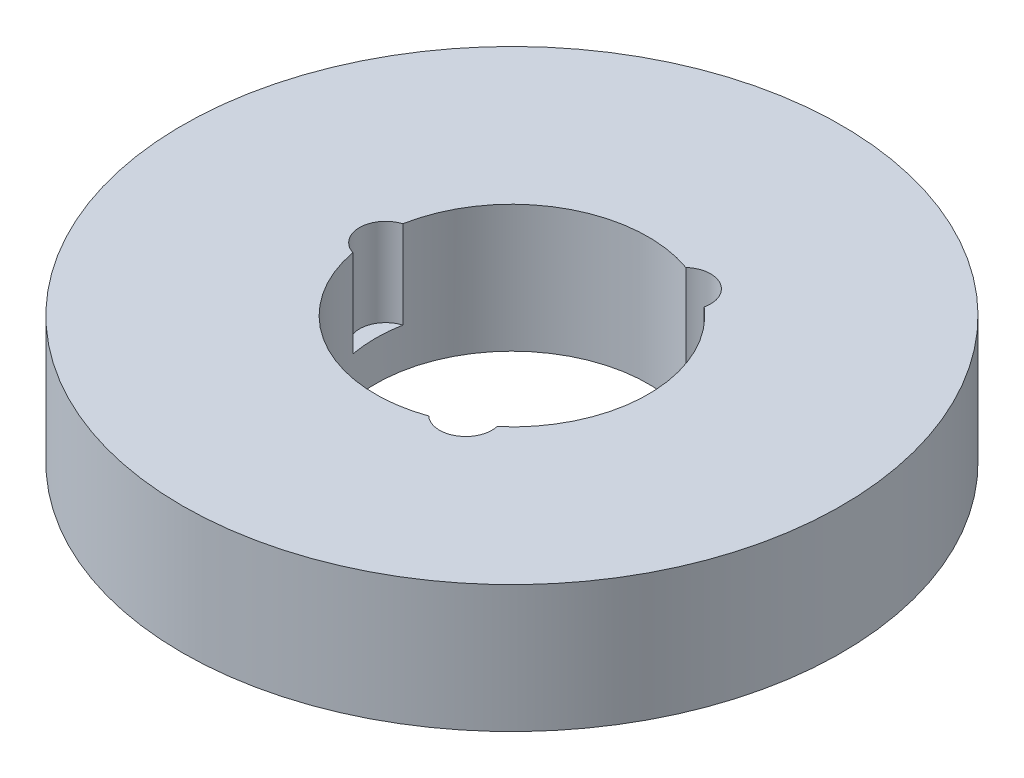
from build123d import *

# Parameters (mm, degrees)
SKETCH1_R           = 72.5
BOSS_EXTRUDE1_DEPTH = 28
SKETCH2_R           = 30
CUT_EXTRUDE1_DEPTH  = 107.284994237
SKETCH3_R           = 5.761569583
CUT_EXTRUDE2_DEPTH  = 19.310243267
CIRPATTERN1_COUNT   = 3


with BuildPart() as part:
    # Sketch1 → Boss-Extrude1 (new body)
    with BuildSketch(Plane(origin=(0, 0, 0), x_dir=(1, 0, 0), z_dir=(0, 1, 0))):
        Circle(SKETCH1_R)
    extrude(amount=BOSS_EXTRUDE1_DEPTH)

    # Sketch2 → Cut-Extrude1 (cut, through all)
    with BuildSketch(Plane(origin=(0, 0, 0), x_dir=(1, 0, 0), z_dir=(0, 1, 0))):
        Circle(SKETCH2_R)
    extrude(amount=CUT_EXTRUDE1_DEPTH, mode=Mode.SUBTRACT)

    # Sketch3 → Cut-Extrude2 (cut)
    with BuildSketch(Plane(origin=(0, 28, 0), x_dir=(1, 0, 0), z_dir=(0, 1, 0))):
        with Locations((-27.772645285, 0)):
            Circle(SKETCH3_R)
    cut_extrude2 = extrude(amount=-CUT_EXTRUDE2_DEPTH, mode=Mode.SUBTRACT)

    # CirPattern1: Cut-Extrude2 ×3 about axis
    cirpattern1_axis = Axis((0, 0, 0), (0, 1, 0))
    for i in range(1, CIRPATTERN1_COUNT):
        add(cut_extrude2.rotate(cirpattern1_axis, i * 360 / CIRPATTERN1_COUNT), mode=Mode.SUBTRACT)


solid = part.part
